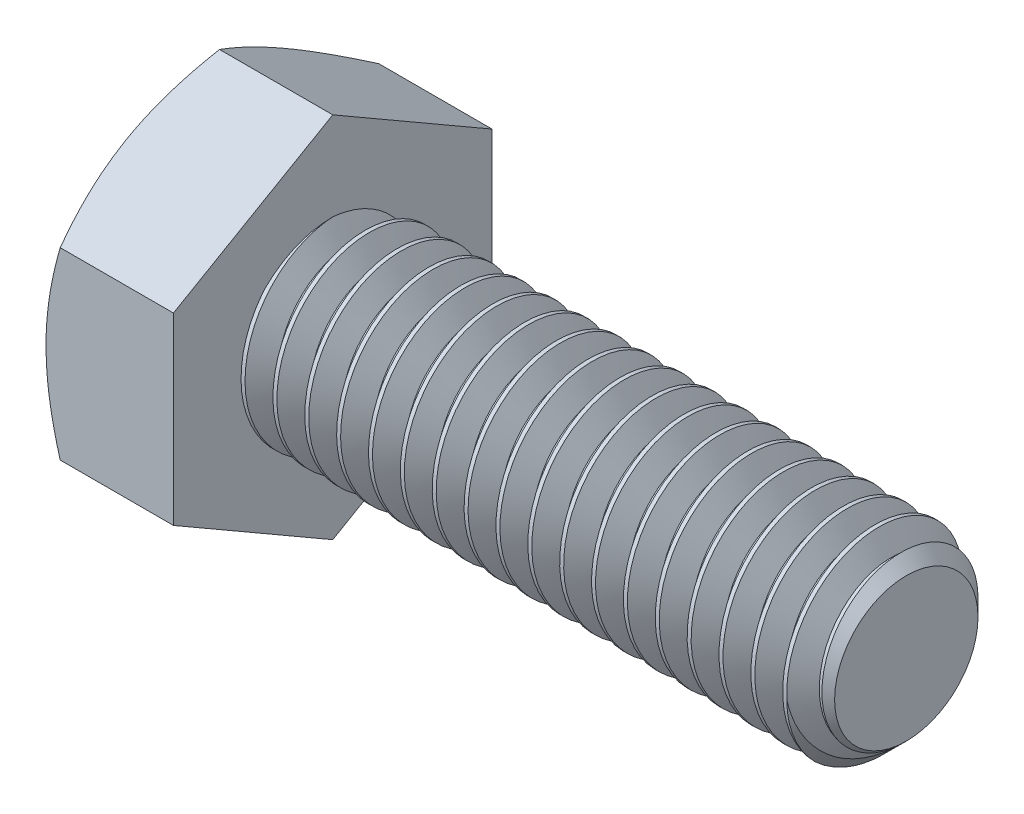
from build123d import *

# Parameters (mm, degrees)
SKETCH2_R           = 3
BOSS_EXTRUDE1_DEPTH = 18
CHAMFER1_SIZE       = 0.75
CUT_SWEEP1_PITCH    = 1
BOSS_EXTRUDE2_DEPTH = 4
SKETCH6_OUTSIDE_W   = 101.492
SKETCH6_OUTSIDE_H   = 103.04
SKETCH6_OUTSIDE_R   = 5
CUT_EXTRUDE1_DEPTH  = 24.28805144
CUT_EXTRUDE1_DRAFT  = -60


with BuildPart() as part:
    # Sketch2 → Boss-Extrude1 (new body)
    with BuildSketch(Plane(origin=(11, 0, 0), x_dir=(0, 0, -1), z_dir=(1, 0, 0))):
        Circle(SKETCH2_R)
    extrude(amount=-BOSS_EXTRUDE1_DEPTH)

    # Chamfer1
    chamfer1_edges = [part.edges().sort_by_distance(p)[0] for p in [
        (11, 0, 3),
    ]]
    chamfer(chamfer1_edges, length=CHAMFER1_SIZE)

    # Cut-Sweep1: the profile of Sketch5 profile screwed along a right-hand helix of 19 turns, 8 arcs to a turn; built about Z, then put on its axis
    cut_sweep1_z = Axis((0, 0, 0), (0, 0, 1))
    cut_sweep1_corners = [(3.0003, 0, 0.000173205), (2.350480947, 0, -0.375), (2.350480947, 0, -0.5), (3.0003, 0, -0.875173205)]
    with BuildLine(mode=Mode.PRIVATE) as cut_sweep1_profile:
        Line(cut_sweep1_corners[0], cut_sweep1_corners[1])
        Line(cut_sweep1_corners[1], cut_sweep1_corners[2])
        Line(cut_sweep1_corners[2], cut_sweep1_corners[3])
        Line(cut_sweep1_corners[3], cut_sweep1_corners[0])
    cut_sweep1_cap = Face(cut_sweep1_profile.wire())
    cut_sweep1_turn_angles = [0, 22.5, 45, 67.5, 90, 112.5, 135, 157.5, 180, 202.5, 225, 247.5, 270, 292.5, 315, 337.5, 360]
    cut_sweep1_turn_weights = [1, 0.9238795325112867, 1, 0.9238795325112867, 1, 0.9238795325112867, 1, 0.9238795325112867, 1, 0.9238795325112867, 1, 0.9238795325112867, 1, 0.9238795325112867, 1, 0.9238795325112867, 1]
    cut_sweep1_turn_rails = [Edge.make_bspline([Vector(p[0], p[1], 0).rotate(cut_sweep1_z, cut_sweep1_turn_angles[k]) / cut_sweep1_turn_weights[k] + Vector(0, 0, p[2] + CUT_SWEEP1_PITCH * cut_sweep1_turn_angles[k] / 360) for k in range(17)], [0, 0, 0, 1, 1, 2, 2, 3, 3, 4, 4, 5, 5, 6, 6, 7, 7, 8, 8, 8], 2, cut_sweep1_turn_weights) for p in cut_sweep1_corners]
    cut_sweep1_turn_sides = [Face.make_surface_from_curves(cut_sweep1_turn_rails[p[0]], cut_sweep1_turn_rails[p[1]]) for p in [(0, 1), (1, 2), (2, 3), (3, 0)]]
    cut_sweep1 = Plane(origin=(11, 0, 0), x_dir=(0, 1, 0), z_dir=(-1, 0, 0)) * Solid(Shell([*[p.moved(Location((0, 0, CUT_SWEEP1_PITCH * i))) for i in range(19) for p in cut_sweep1_turn_sides], cut_sweep1_cap, cut_sweep1_cap.rotate(cut_sweep1_z, 6840).moved(Location((0, 0, CUT_SWEEP1_PITCH * 6840 / 360)))]))
    add(cut_sweep1, mode=Mode.SUBTRACT)

    # Sketch3 → Boss-Extrude2 (add)
    with BuildSketch(Plane.ZY.offset(7)):
        Polygon((-5, -2.886751346), (0, -5.773502692), (5, -2.886751346), (5, 2.886751346), (0, 5.773502692), (-5, 2.886751346), align=None)
    extrude(amount=BOSS_EXTRUDE2_DEPTH)


with BuildPart() as cut_extrude1_tool:
    # Sketch6 outside → Cut-Extrude1 (with draft: the straight prism first)
    with BuildSketch(Plane.ZY.offset(11)):
        Rectangle(SKETCH6_OUTSIDE_W, SKETCH6_OUTSIDE_H)
        Circle(SKETCH6_OUTSIDE_R, mode=Mode.SUBTRACT)
    extrude(amount=-CUT_EXTRUDE1_DEPTH)
    # Cut-Extrude1: the draft: its side faces are tilted about the plane it starts from
    cut_extrude1_sides = [cut_extrude1_tool.faces().sort_by_distance(p)[0] for p in [
        (1.14402572, -51.52, 0),
        (1.14402572, 0, 50.746),
        (1.14402572, 51.52, 0),
        (1.14402572, 0, -50.746),
        (1.14402572, 0, -5),
    ]]
    draft(cut_extrude1_sides, Plane.ZY.offset(11), CUT_EXTRUDE1_DRAFT)


with BuildPart() as part_1:
    add(part.part)

    # Cut-Extrude1: cut by cut_extrude1_tool
    add(cut_extrude1_tool.part, mode=Mode.SUBTRACT)


solid = part_1.part
